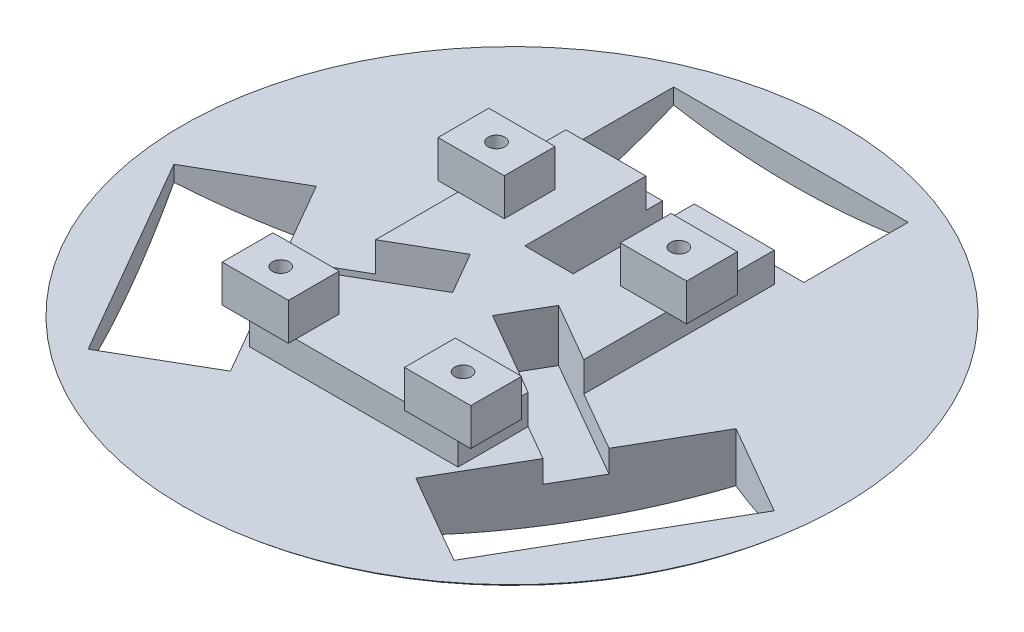
from build123d import *

# Parameters (mm, degrees)
SKETCH2_W           = 63
SKETCH2_H           = 28
CUT_EXTRUDE1_DEPTH  = 40
SKETCH4_W           = 13
SKETCH4_H           = 37
CUT_EXTRUDE2_DEPTH  = 6
SKETCH5_R           = 2.25
BOSS_EXTRUDE1_DEPTH = 8
SKETCH6_W           = 17.804636944
SKETCH6_H           = 13.641488334
SKETCH6_R           = 2.25
BOSS_EXTRUDE2_DEPTH = 10


with BuildPart() as part:
    # Sketch3 → Revolve1 (revolve)
    with BuildSketch(Plane(origin=(0, 0, 0), x_dir=(0, 0, -1), z_dir=(1, 0, 0))):
        with BuildLine():
            Line((0, 20), (0, 0))
            ThreePointArc((0, 0), (43.440585665, 3.508757487), (84.753971762, 17.38679738))
            ThreePointArc((84.753971762, 17.38679738), (86.762776598, 18.545504508), (88.56897203, 20))
            Line((88.56897203, 20), (0, 20))
        make_face()
    revolve(axis=Axis((0, 20, 0), (0, -1, 0)))

    # Sketch2 → Cut-Extrude1 (cut)
    with BuildSketch(Plane(origin=(0, 0, 0), x_dir=(1, 0, 0), z_dir=(0, 1, 0))):
        with Locations((0, 60.949465814)):
            Rectangle(SKETCH2_W, SKETCH2_H)
        Polygon((80.658141395, -10.194932688), (49.158141395, -64.754533126), (24.909430089, -50.754533126), (56.409430089, 3.805067312), align=None)
        Polygon((-49.158141395, -64.754533126), (-80.658141395, -10.194932688), (-56.409430089, 3.805067312), (-24.909430089, -50.754533126), align=None)
    extrude(amount=CUT_EXTRUDE1_DEPTH, mode=Mode.SUBTRACT)

    # Sketch4 → Cut-Extrude2 (cut)
    with BuildSketch(Plane(origin=(0, 20, 0), x_dir=(1, 0, 0), z_dir=(0, 1, 0))):
        with Locations((0, 28.449465814)):
            Rectangle(SKETCH4_W, SKETCH4_H)
        Polygon((37.409430089, -29.103898031), (43.909430089, -17.845567782), (11.866490149, 0.654432218), (5.366490149, -10.603898031), align=None)
        Polygon((-43.909430089, -17.845567782), (-37.409430089, -29.103898031), (-5.366490149, -10.603898031), (-11.866490149, 0.654432218), align=None)
    extrude(amount=-CUT_EXTRUDE2_DEPTH, mode=Mode.SUBTRACT)

    # Sketch5 → Boss-Extrude1 (add)
    with BuildSketch(Plane(origin=(0, 20, 0), x_dir=(1, 0, 0), z_dir=(0, 1, 0))):
        Polygon((-28, 42.5), (-6.5, 42.5), (-6.5, 9.949465814), (6.5, 9.949465814), (6.5, 42.5), (28, 42.5), (27.887960119, -8.595567782), (11.866490149, 0.654432218), (5.366490149, -10.603898031), (28, -23.671361037), (28, -42.5), (-28, -42.5), (-28, -23.671361037), (-5.366490149, -10.603898031), (-11.866490149, 0.654432218), (-28, -8.660254038), align=None)
        with Locations((-24.5, -37.660254038)):
            Circle(SKETCH5_R, mode=Mode.SUBTRACT)
        with Locations((24.5, -37.660254038)):
            Circle(SKETCH5_R, mode=Mode.SUBTRACT)
        with Locations((24.5, 20.339745962)):
            Circle(SKETCH5_R, mode=Mode.SUBTRACT)
        with Locations((-24.5, 20.339745962)):
            Circle(SKETCH5_R, mode=Mode.SUBTRACT)
    extrude(amount=BOSS_EXTRUDE1_DEPTH)

    # Sketch6 → Boss-Extrude2 (add)
    # profile 1 of 4: a face of its own
    with BuildSketch(Plane(origin=(0, 28, 0), x_dir=(1, 0, 0), z_dir=(0, 1, 0))):
        with Locations((-24.5, 20.339745962)):
            Rectangle(SKETCH6_W, SKETCH6_H)
        with Locations((-24.5, 20.339745962)):
            Circle(SKETCH6_R, mode=Mode.SUBTRACT)
    # profile 2 of 4: a face of its own
    with BuildSketch(Plane(origin=(0, 28, 0), x_dir=(1, 0, 0), z_dir=(0, 1, 0))):
        with Locations((24.5, 20.339745962)):
            Rectangle(SKETCH6_W, SKETCH6_H)
        with Locations((24.5, 20.339745962)):
            Circle(SKETCH6_R, mode=Mode.SUBTRACT)
    # profile 3 of 4: a face of its own
    with BuildSketch(Plane(origin=(0, 28, 0), x_dir=(1, 0, 0), z_dir=(0, 1, 0))):
        with Locations((24.5, -37.660254038)):
            Rectangle(SKETCH6_W, SKETCH6_H)
        with Locations((24.5, -37.660254038)):
            Circle(SKETCH6_R, mode=Mode.SUBTRACT)
    # profile 4 of 4: a face of its own
    with BuildSketch(Plane(origin=(0, 28, 0), x_dir=(1, 0, 0), z_dir=(0, 1, 0))):
        with Locations((-24.5, -37.660254038)):
            Rectangle(SKETCH6_W, SKETCH6_H)
        with Locations((-24.5, -37.660254038)):
            Circle(SKETCH6_R, mode=Mode.SUBTRACT)
    extrude(amount=BOSS_EXTRUDE2_DEPTH)


solid = part.part
